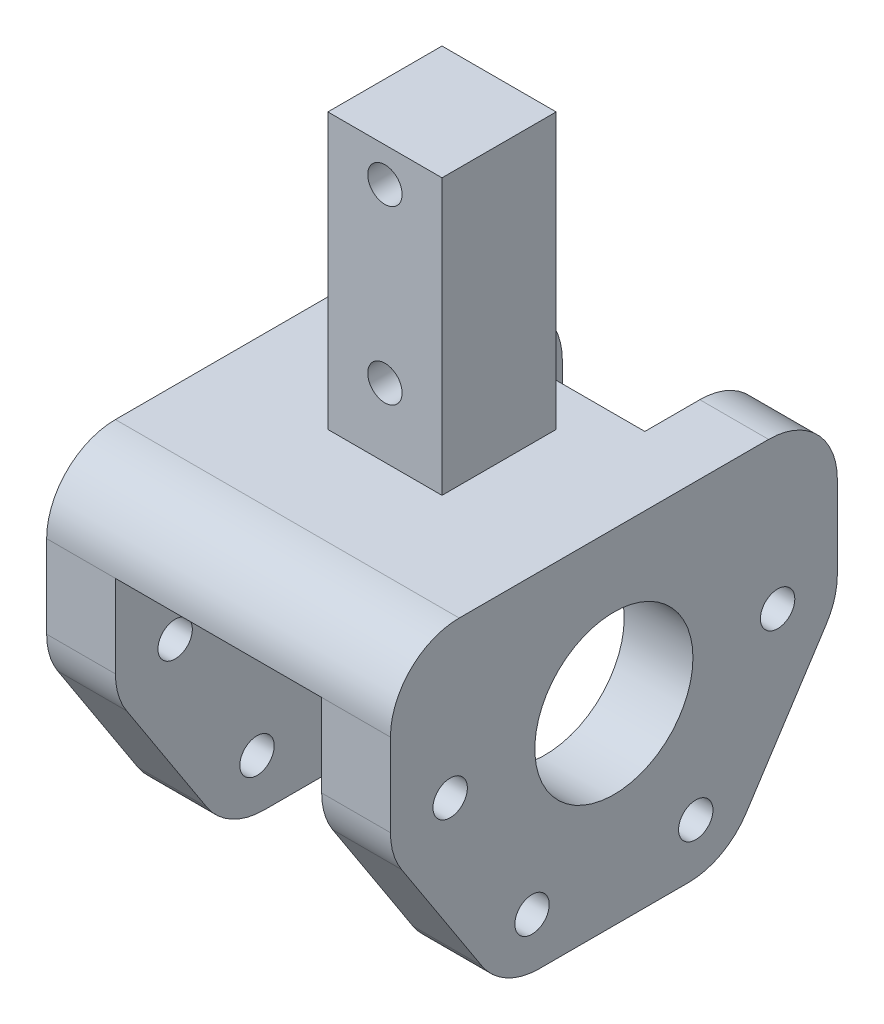
from build123d import *
from OCP.BRepFilletAPI import BRepFilletAPI_MakeChamfer

# Parameters (mm, degrees)
ESBO_O1_W                = 16.6
ESBO_O1_H                = 16.6
RESSALTO_EXTRUS_O1_DEPTH = 40
ESBO_O2_W                = 50
ESBO_O2_H                = 65
RESSALTO_EXTRUS_O2_DEPTH = 50
ESBO_O3_W                = 30
ESBO_O3_H                = 40
CORTE_EXTRUS_O1_DEPTH    = 86.732140997
ESBO_O4_R                = 11.5
ESBO_O4_R_2              = 2.5
CORTE_EXTRUS_O2_DEPTH    = 78.821912081
ESBO_O5_W                = 18
ESBO_O5_H                = 5
CORTE_EXTRUS_O3_DEPTH    = 10
CHANFRO1_SIZE            = 25
CHANFRO1_SIZE2           = 16.23518983
FILETE2_R                = 10
ESBO_O8_W                = 18
ESBO_O8_H                = 5
CORTE_EXTRUS_O5_DEPTH    = 30
FILETE4_R                = 10
ESBO_O9_R                = 2.5
CORTE_EXTRUS_O7_DEPTH    = 70.207225056


with BuildPart() as part:
    # Esboço1 → Ressalto-extrusão1 (new body)
    with BuildSketch(Plane(origin=(0, 0, 0), x_dir=(1, 0, 0), z_dir=(0, 1, 0))):
        Rectangle(ESBO_O1_W, ESBO_O1_H)
    extrude(amount=RESSALTO_EXTRUS_O1_DEPTH)

    # Esboço2 → Ressalto-extrusão2 (add)
    with BuildSketch(Plane.XZ):
        Rectangle(ESBO_O2_W, ESBO_O2_H)
    extrude(amount=RESSALTO_EXTRUS_O2_DEPTH)

    # Esboço3 → Corte-extrusão1 (cut, through all)
    with BuildSketch(Plane.XY.offset(32.5)):
        with Locations((0, -30)):
            Rectangle(ESBO_O3_W, ESBO_O3_H)
    extrude(amount=-CORTE_EXTRUS_O1_DEPTH, mode=Mode.SUBTRACT)

    # Esboço4 → Corte-extrusão2 (cut, through all)
    with BuildSketch(Plane(origin=(25, 0, 0), x_dir=(0, 0, -1), z_dir=(1, 0, 0))):
        with Locations((0, -22)):
            Circle(ESBO_O4_R)
        with Locations((-23.8125, -22)):
            Circle(ESBO_O4_R_2)
        with Locations((23.8125, -22)):
            Circle(ESBO_O4_R_2)
        with Locations((-11.90625, -42.622229928)):
            Circle(ESBO_O4_R_2)
        with Locations((11.90625, -42.622229928)):
            Circle(ESBO_O4_R_2)
    extrude(amount=-CORTE_EXTRUS_O2_DEPTH, mode=Mode.SUBTRACT)

    # Esboço5 → Corte-extrusão3 (cut)
    with BuildSketch(Plane.ZY.offset(25)):
        with Locations((-23.5, -2.5)):
            Rectangle(ESBO_O5_W, ESBO_O5_H)
    extrude(amount=-CORTE_EXTRUS_O3_DEPTH, mode=Mode.SUBTRACT)

    # Chanfro1: one chamfer whose edges measure the first distance from different faces: ONE call of the kernel's chamfer builder (chamfer() names one face for all edges)
    chanfro1_edges_1 = [part.edges().sort_by_distance(p)[0] for p in [
        (20, -50, 32.5),
        (-20, -50, 32.5),
    ]]
    chanfro1_side_1 = [part.faces().sort_by_distance(p)[0] for p in [
        (0, -0.707106781, 32.5),
    ]]
    chanfro1_edges_2 = [part.edges().sort_by_distance(p)[0] for p in [
        (-20, -50, -32.5),
        (20, -50, -32.5),
    ]]
    chanfro1_side_2 = [part.faces().sort_by_distance(p)[0] for p in [
        (5, -0.707106781, -32.5),
    ]]
    chanfro1 = BRepFilletAPI_MakeChamfer(part.part.solid().wrapped)
    for e in chanfro1_edges_1:
        chanfro1.Add(CHANFRO1_SIZE, CHANFRO1_SIZE2, e.wrapped, chanfro1_side_1[0].wrapped)  # the first distance lies on this face
    for e in chanfro1_edges_2:
        chanfro1.Add(CHANFRO1_SIZE, CHANFRO1_SIZE2, e.wrapped, chanfro1_side_2[0].wrapped)  # the first distance lies on this face
    add(Compound.cast(chanfro1.Shape()), mode=Mode.REPLACE)

    # Filete2
    # the kernel refuses this fillet: 10 mm, written as the material it takes off along each edge
    with BuildSketch(Plane(origin=(7.594662626, -25, -32.5), x_dir=(0, 1, 0), z_dir=(1, 0, 0)), Plane(origin=(-32.405337374, -25, -32.5), x_dir=(0, 1, 0), z_dir=(1, 0, 0)), Plane(origin=(32.405337374, -25, 32.5), x_dir=(0, 1, 0), z_dir=(-1, 0, 0)), Plane(origin=(-7.594662626, -25, 32.5), x_dir=(0, 1, 0), z_dir=(-1, 0, 0))) as filete2_piece_1:
        with BuildLine():
            CenterArc((FILETE2_R * 0.296213494962, FILETE2_R), FILETE2_R, 237, 33)
            Line((-FILETE2_R * 0.248425540053, FILETE2_R * 0.161329432055), (0, 0))
            Line((0, 0), (FILETE2_R * 0.296213494962, 0))
        make_face()
    extrude(amount=24.810674748, mode=Mode.SUBTRACT)
    with BuildSketch(Plane(origin=(1.426107509, -50, -16.26481017), x_dir=(0, 0.8386705679454236, -0.5446390350150278), z_dir=(1, 0, 0)), Plane(origin=(-1.426107509, -50, 16.26481017), x_dir=(0, 0.8386705679454233, 0.5446390350150284), z_dir=(-1, 0, 0)), Plane(origin=(-38.573892491, -50, -16.26481017), x_dir=(0, 0.8386705679454236, -0.5446390350150278), z_dir=(1, 0, 0))) as filete2_piece_2:
        with BuildLine():
            CenterArc((FILETE2_R * 0.542955699638, FILETE2_R), FILETE2_R, 213, 57)
            Line((-FILETE2_R * 0.295714868307, FILETE2_R * 0.455360964985), (0, 0))
            Line((0, 0), (FILETE2_R * 0.542955699638, 0))
        make_face()
    extrude(amount=37.147784982, mode=Mode.SUBTRACT)
    with BuildSketch(Plane(origin=(38.573892491, -50, 16.26481017), x_dir=(0, 0, -1), z_dir=(-1, 0, 0))) as filete2_piece_3:
        with BuildLine():
            CenterArc((FILETE2_R * 0.542955699638, -FILETE2_R), FILETE2_R, 90, 57)
            Line((-FILETE2_R * 0.295714868307, -FILETE2_R * 0.455360964985), (0, 0))
            Line((0, 0), (FILETE2_R * 0.542955699638, 0))
        make_face()
    extrude(amount=37.147784982, mode=Mode.SUBTRACT)
    with BuildSketch(Plane(origin=(50, 0, 32.5), x_dir=(0, 0, -1), z_dir=(-1, 0, 0))) as filete2_piece_4:
        with BuildLine():
            CenterArc((FILETE2_R, FILETE2_R), FILETE2_R, 180, 90)
            Line((0, FILETE2_R), (0, 0))
            Line((0, 0), (FILETE2_R, 0))
        make_face()
    extrude(amount=100, mode=Mode.SUBTRACT)
    with BuildSketch(Plane(origin=(-50, -5, -32.5), x_dir=(0, -1, 0), z_dir=(1, 0, 0))) as filete2_piece_5:
        with BuildLine():
            CenterArc((FILETE2_R, -FILETE2_R), FILETE2_R, 90, 90)
            Line((0, -FILETE2_R), (0, 0))
            Line((0, 0), (FILETE2_R, 0))
        make_face()
    extrude(amount=35, mode=Mode.SUBTRACT)

    # Esboço8 → Corte-extrusão5 (cut)
    with BuildSketch(Plane.ZY.offset(15)):
        with Locations((-23.5, -2.5)):
            Rectangle(ESBO_O8_W, ESBO_O8_H)
        with Locations((-23.5, -7.5)):
            Rectangle(ESBO_O8_W, ESBO_O8_H)
    extrude(amount=-CORTE_EXTRUS_O5_DEPTH, mode=Mode.SUBTRACT)

    # Filete4
    filete4_edges = [part.edges().sort_by_distance(p)[0] for p in [
        (20, 0, -32.5),
    ]]
    fillet(filete4_edges, radius=FILETE4_R)

    # Esboço9 → Corte-extrusão7 (cut, through all)
    with BuildSketch(Plane(origin=(0, 0, 8.3), x_dir=(-1, 0, 0), z_dir=(0, 0, -1))):
        with Locations(Location((0, 10, 0), (0, 0, 180))):
            Circle(ESBO_O9_R)
        with Locations(Location((0, 35, 0), (0, 0, 180))):
            Circle(ESBO_O9_R)
    extrude(amount=CORTE_EXTRUS_O7_DEPTH, mode=Mode.SUBTRACT)


solid = part.part
